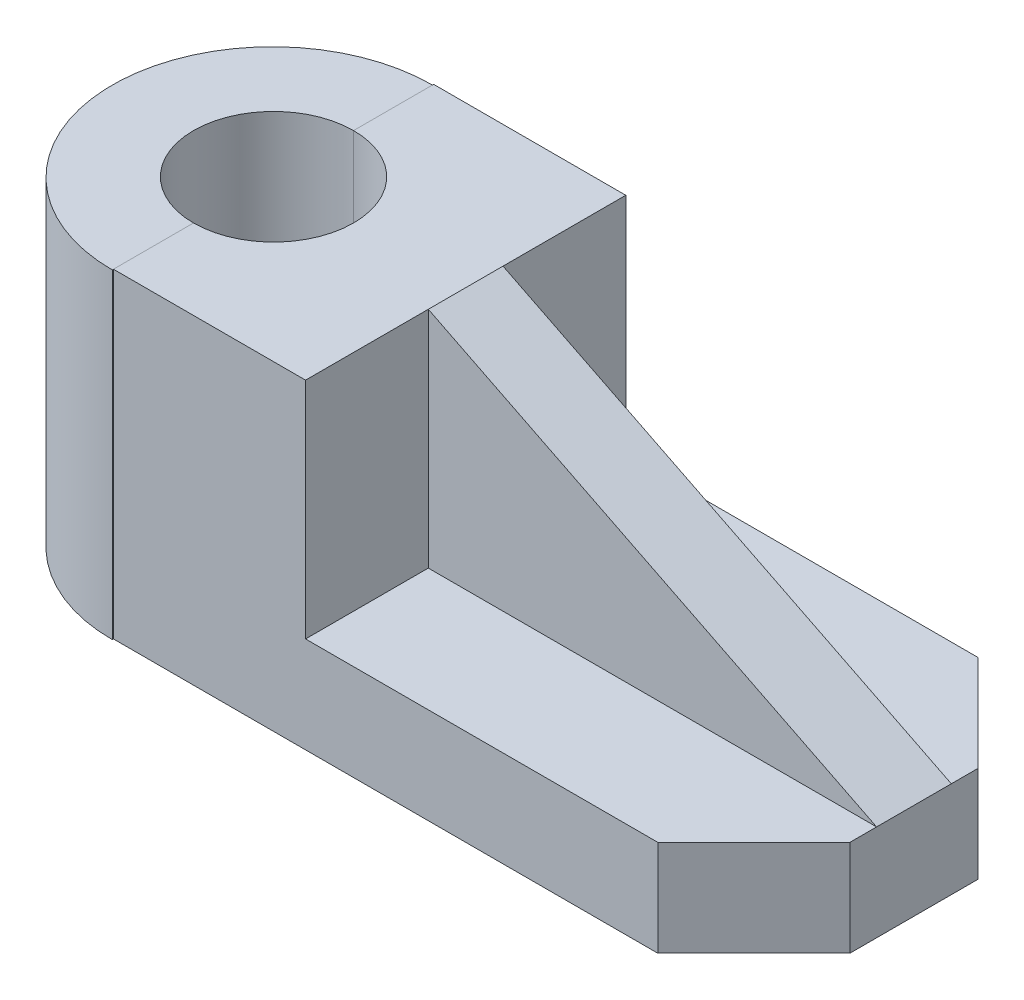
from build123d import *

# Parameters (mm, degrees)
BOSS_EXTRUDE1_DEPTH      = 15
BOSS_EXTRUDE1_DEPTH_BACK = 15
BOSS_EXTRUDE2_DEPTH      = 30
CHAMFER1_SIZE            = 9
CHAMFER2_SIZE            = 9
SKETCH3_R                = 7.5
CUT_EXTRUDE2_DEPTH       = 54.780246911
RIB14_REACH              = 55.78
SKETCH16_WALL_W          = 156.51792135
SKETCH16_WALL_H          = 7


with BuildPart() as part:
    # Sketch1 → Boss-Extrude1 (new, two sides: drawn at the far end of the back side and taken through both)
    with BuildSketch(Plane.XY.offset(-BOSS_EXTRUDE1_DEPTH_BACK)):
        Polygon((-18, 30), (0, 30), (0, 9), (42, 9), (42, 0), (0, 0), (-18, 0), align=None)
    extrude(amount=BOSS_EXTRUDE1_DEPTH + BOSS_EXTRUDE1_DEPTH_BACK)

    # Chamfer1
    chamfer1_edges = [part.edges().sort_by_distance(p)[0] for p in [
        (42, 4.5, 15),
    ]]
    chamfer(chamfer1_edges, length=CHAMFER1_SIZE)

    # Chamfer2
    chamfer2_edges = [part.edges().sort_by_distance(p)[0] for p in [
        (42, 4.5, -15),
    ]]
    chamfer(chamfer2_edges, length=CHAMFER2_SIZE)


with BuildPart() as body_2:
    # Sketch2 → Boss-Extrude2 (new body)
    with BuildSketch(Plane(origin=(0, 30, 0), x_dir=(1, 0, 0), z_dir=(0, 1, 0))):
        with BuildLine():
            Line((-18, 14.889905433), (-18, -15.110094567))
            ThreePointArc((-18, -15.110094567), (-33, -0.110094567), (-18, 14.889905433))
        make_face()
    extrude(amount=-BOSS_EXTRUDE2_DEPTH)


with BuildPart() as cut_extrude2_tool:
    # Sketch3 → Cut-Extrude2 (new, through all)
    with BuildSketch(Plane(origin=(0, 30, 0), x_dir=(1, 0, 0), z_dir=(0, 1, 0))):
        with Locations((-18, 0)):
            Circle(SKETCH3_R)
    extrude(amount=-CUT_EXTRUDE2_DEPTH)


with BuildPart() as part_1:
    add(part.part)

    # Cut-Extrude2: cut by cut_extrude2_tool
    add(cut_extrude2_tool.part, mode=Mode.SUBTRACT)

    # Sketch16 wall → Rib14 (add, up to next)
    with BuildSketch(Plane(origin=(21, 19.5, 0), x_dir=(0.894427191, -0.4472135955, 0), z_dir=(0.4472135955, 0.894427191, 0)), mode=Mode.PRIVATE) as rib14_sk1:
        Rectangle(SKETCH16_WALL_W, SKETCH16_WALL_H)
    rib14_tool1 = extrude(rib14_sk1.sketch, amount=-RIB14_REACH, mode=Mode.PRIVATE) - part_1.part
    add(rib14_tool1.solids().sort_by_distance((21, 19.5, 0))[0])


with BuildPart() as body_2_1:
    add(body_2.part)

    # Cut-Extrude2: cut by cut_extrude2_tool
    add(cut_extrude2_tool.part, mode=Mode.SUBTRACT)


solid = Compound([part_1.part, body_2_1.part])
